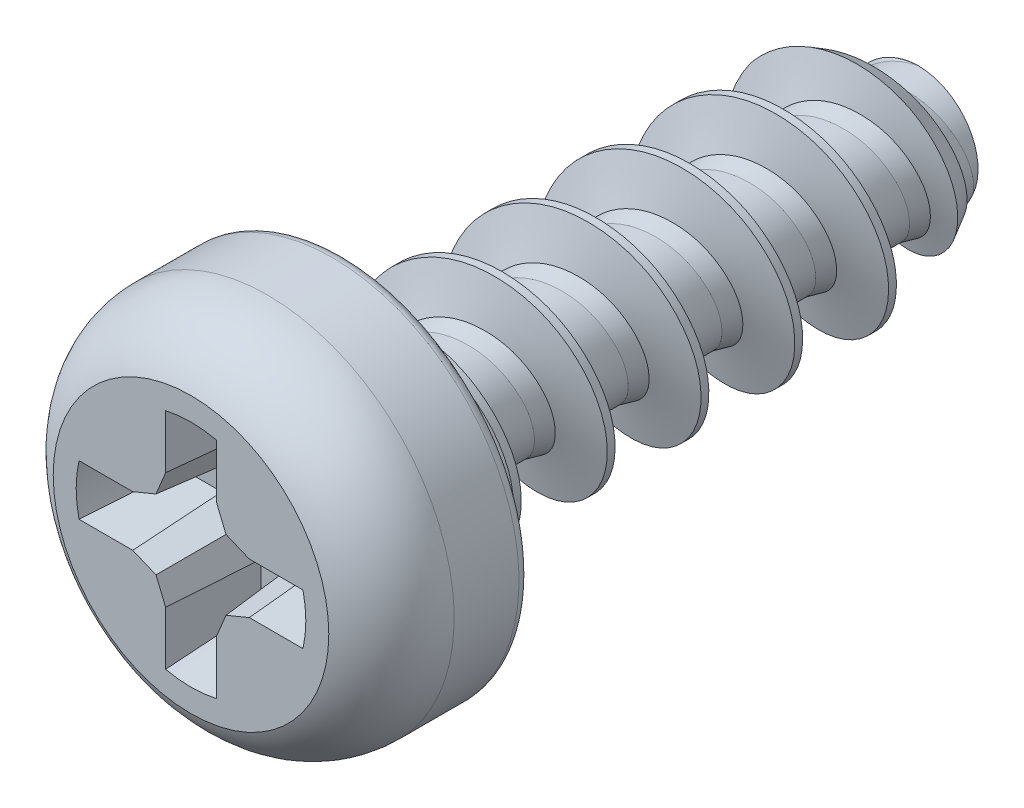
from build123d import *

# Parameters (mm, degrees)
CUT_EXTRUDE1_DEPTH      = 0.914285714
CIRPATTERN1_COUNT       = 4
DRAFT2_ANGLE            = 5
FILLET1_R               = 0.1225
SWEEP2_PITCH            = 0.98
CUT_EXTRUDE4_DEPTH      = 9.132806369
CUT_EXTRUDE4_DEPTH_BACK = 9.132806369
SKETCH16_W              = 1.6
SKETCH16_H              = 3.9
SKETCH16_W_2            = 2.45
SKETCH14_R              = 1.1
BOSS_EXTRUDE3_DEPTH     = 0.3
SKETCH15_R              = 1.1
BOSS_EXTRUDE4_DEPTH     = 0.9
BOSS_EXTRUDE4_DRAFT     = -39


# Read off the part's stored shape, not the designer's step: Draft1
with BuildPart() as part:
    # Sketch3 → Revolve1 (revolve)
    with BuildSketch(Plane(origin=(0, 0, 0), x_dir=(0, 0, -1), z_dir=(1, 0, 0)), mode=Mode.PRIVATE) as revolve1_sk:
        Polygon((0, 0.625), (0, 1.95), (-1.6, 1.95), (-1.6, 0), (6, 0), (6, 0.625), align=None)
    revolve(revolve1_sk.sketch.rotate(Axis((0, 0, 1.6), (0, 0, -1)), 180), axis=Axis((0, 0, 1.6), (0, 0, -1)))

    # Sketch4 → Cut-Revolve1 (revolve, cut)
    with BuildSketch(Plane(origin=(0, 0, 0), x_dir=(0, 0, -1), z_dir=(1, 0, 0)), mode=Mode.PRIVATE) as cut_revolve1_sk:
        with BuildLine():
            Line((-1.6, 1.44), (-1.8, 1.44))
            Line((-1.8, 1.44), (-1.8, 2.15))
            Line((-1.8, 2.15), (0, 2.15))
            Line((0, 2.15), (0, 1.95))
            Line((0, 1.95), (-0.8, 1.95))
            ThreePointArc((-0.8, 1.95), (-1.274368001, 1.811655687), (-1.6, 1.44))
        make_face()
    revolve(cut_revolve1_sk.sketch.rotate(Axis((0, 0, 0), (0, 0, 1)), 180), axis=Axis((0, 0, 0), (0, 0, 1)), mode=Mode.SUBTRACT)

    # Sketch5 → Cut-Extrude1 (cut)
    with BuildSketch(Plane.XY.offset(1.6)):
        with BuildLine():
            Line((0, 1.2), (0, 0))
            Line((0, 0), (1.2, 0))
            ThreePointArc((1.2, 0), (1.196398288, 0.092903843), (1.185614793, 0.18525))
            Line((1.185614793, 0.18525), (0.592807397, 0.18525))
            Line((0.592807397, 0.18525), (0.304620798, 0.304620798))
            Line((0.304620798, 0.304620798), (0.18525, 0.592807397))
            Line((0.18525, 0.592807397), (0.18525, 1.185614793))
            ThreePointArc((0.18525, 1.185614793), (0.092903844, 1.196398293), (0, 1.2))
        make_face()
    cut_extrude1 = extrude(amount=-CUT_EXTRUDE1_DEPTH, mode=Mode.SUBTRACT)

    # CirPattern1: Cut-Extrude1 ×4 about axis
    cirpattern1_axis = Axis((0, 0, 0), (0, 0, 1))
    for i in range(1, CIRPATTERN1_COUNT):
        add(cut_extrude1.rotate(cirpattern1_axis, i * 360 / CIRPATTERN1_COUNT), mode=Mode.SUBTRACT)

    # Draft1 outline → Draft1 (revolve)
    with BuildSketch(Plane.XZ):
        Polygon((1.2, 1.6), (1.03878676, 0.685714286), (1.2, 0.685714286), align=None)
    revolve(axis=Axis((0, 0, 0), (0, 0, 1)))

    # Draft2
    draft2_faces = [part.faces().sort_by_distance(p)[0] for p in [
        (0.18525, 0.850547535, 1.167225457),
        (0.244935399, 0.448714097, 1.142857143),
        (0.448714097, 0.244935399, 1.142857143),
        (0.850547535, 0.18525, 1.167225457),
        (0.850547535, -0.18525, 1.167225457),
        (0.448714097, -0.244935399, 1.142857143),
        (0.244935399, -0.448714097, 1.142857143),
        (0.18525, -0.850547535, 1.167225457),
        (-0.18525, -0.850547535, 1.167225457),
        (-0.244935399, -0.448714097, 1.142857143),
        (-0.448714097, -0.244935399, 1.142857143),
        (-0.850547535, -0.18525, 1.167225457),
        (-0.850547535, 0.18525, 1.167225457),
        (-0.448714097, 0.244935399, 1.142857143),
        (-0.244935399, 0.448714097, 1.142857143),
        (-0.18525, 0.850547535, 1.167225457),
    ]]
    draft(draft2_faces, Plane(origin=(-1.837e-06, -1.43e-07, 0.685714286), x_dir=(1, 0, 0), z_dir=(0, 0, 1)), DRAFT2_ANGLE)

    # Fillet1
    fillet1_edges = [part.edges().sort_by_distance(p)[0] for p in [
        (0, 1.95, 0),
    ]]
    fillet(fillet1_edges, radius=FILLET1_R)


with BuildPart() as body_2:
    # Split1: the piece on the far side of the plane
    add(part.part)
    split(bisect_by=Plane.XY, keep=Keep.BOTTOM)

    # Sweep2: the profile of Sketch9 screwed along a right-hand helix of 8.122449 turns, 8 arcs to a turn; built about Z, then put on its axis
    sweep2_z = Axis((0, 0, 0), (0, 0, 1))
    sweep2_corners = [(1.1, 0, -0.294658045), (1.1, 0, -0.376324711), (0.665833333, 0, -0.492659319), (0.625, 0, -0.670982756), (0.463471328, 0, -0.670982756), (0.463471328, 0, 0), (0.625, 0, 0), (0.665833333, 0, -0.178323437)]
    with BuildLine(mode=Mode.PRIVATE) as sweep2_profile:
        Line(sweep2_corners[0], sweep2_corners[1])
        Line(sweep2_corners[1], sweep2_corners[2])
        Line(sweep2_corners[2], sweep2_corners[3])
        Line(sweep2_corners[3], sweep2_corners[4])
        Line(sweep2_corners[4], sweep2_corners[5])
        Line(sweep2_corners[5], sweep2_corners[6])
        Line(sweep2_corners[6], sweep2_corners[7])
        Line(sweep2_corners[7], sweep2_corners[0])
    sweep2_cap = Face(sweep2_profile.wire())
    sweep2_turn_angles = [0, 22.5, 45, 67.5, 90, 112.5, 135, 157.5, 180, 202.5, 225, 247.5, 270, 292.5, 315, 337.5, 360]
    sweep2_turn_weights = [1, 0.9238795325112867, 1, 0.9238795325112867, 1, 0.9238795325112867, 1, 0.9238795325112867, 1, 0.9238795325112867, 1, 0.9238795325112867, 1, 0.9238795325112867, 1, 0.9238795325112867, 1]
    sweep2_turn_rails = [Edge.make_bspline([Vector(p[0], p[1], 0).rotate(sweep2_z, sweep2_turn_angles[k]) / sweep2_turn_weights[k] + Vector(0, 0, p[2] + SWEEP2_PITCH * sweep2_turn_angles[k] / 360) for k in range(17)], [0, 0, 0, 1, 1, 2, 2, 3, 3, 4, 4, 5, 5, 6, 6, 7, 7, 8, 8, 8], 2, sweep2_turn_weights) for p in sweep2_corners]
    sweep2_turn_sides = [Face.make_surface_from_curves(sweep2_turn_rails[p[0]], sweep2_turn_rails[p[1]]) for p in [(0, 1), (1, 2), (2, 3), (3, 4), (4, 5), (5, 6), (6, 7), (7, 0)]]
    sweep2_last_angles = [2880, 2902.040816327, 2924.081632653]
    sweep2_last_weights = [1, 0.9269167573459905, 1]
    sweep2_last_rails = [Edge.make_bspline([Vector(p[0], p[1], 0).rotate(sweep2_z, sweep2_last_angles[k]) / sweep2_last_weights[k] + Vector(0, 0, p[2] + SWEEP2_PITCH * sweep2_last_angles[k] / 360) for k in range(3)], [0, 0, 0, 1, 1, 1], 2, sweep2_last_weights) for p in sweep2_corners]
    sweep2_last_sides = [Face.make_surface_from_curves(sweep2_last_rails[p[0]], sweep2_last_rails[p[1]]) for p in [(0, 1), (1, 2), (2, 3), (3, 4), (4, 5), (5, 6), (6, 7), (7, 0)]]
    sweep2 = Plane(origin=(0, 0, -6.98), x_dir=(0, 1, 0), z_dir=(0, 0, 1)) * Solid(Shell([*[p.moved(Location((0, 0, SWEEP2_PITCH * i))) for i in range(8) for p in sweep2_turn_sides], *sweep2_last_sides, sweep2_cap, sweep2_cap.rotate(sweep2_z, 2924.081632653).moved(Location((0, 0, SWEEP2_PITCH * 2924.081632653 / 360)))]))
    add(sweep2)

    # Sketch16 → Cut-Extrude4 (cut, two sides: drawn at the far end of the back side and taken through both)
    with BuildSketch(Plane(origin=(0, 0, 0), x_dir=(0, 0, -1), z_dir=(1, 0, 0)).offset(-CUT_EXTRUDE4_DEPTH_BACK)):
        with Locations((-0.8, 0)):
            Rectangle(SKETCH16_W, SKETCH16_H)
        with Locations((7.225, 0)):
            Rectangle(SKETCH16_W_2, SKETCH16_H)
    extrude(amount=CUT_EXTRUDE4_DEPTH + CUT_EXTRUDE4_DEPTH_BACK, mode=Mode.SUBTRACT)

    # Sketch13 → Cut-Revolve2 (revolve, cut)
    with BuildSketch(Plane(origin=(0, 0, 0), x_dir=(0, 0, -1), z_dir=(1, 0, 0))):
        Polygon((6, 1.95), (6, 0.625), (3.658070428, 1.95), align=None)
    revolve(axis=Axis((0, 0, 0), (0, 0, -1)), mode=Mode.SUBTRACT)


with BuildPart() as part_1:
    add(part.part)

    # Split1
    split(bisect_by=Plane.XY, keep=Keep.TOP)

    add(body_2.part)  # Boss-Extrude3 merges body 2
    # Sketch14 → Boss-Extrude3 (add)
    with BuildSketch(Plane.XY):
        Circle(SKETCH14_R)
    extrude(amount=-BOSS_EXTRUDE3_DEPTH)


with BuildPart() as boss_extrude4_tool:
    # Sketch15 → Boss-Extrude4 (with draft: the straight prism first)
    with BuildSketch(Plane.XY.offset(-0.3)):
        Circle(SKETCH15_R)
    extrude(amount=-BOSS_EXTRUDE4_DEPTH)
    # Boss-Extrude4: the draft: its side faces are tilted about the plane it starts from
    boss_extrude4_sides = [boss_extrude4_tool.faces().sort_by_distance(p)[0] for p in [
        (-1.1, 0, -0.75),
    ]]
    draft(boss_extrude4_sides, Plane.XY.offset(-0.3), BOSS_EXTRUDE4_DRAFT)


with BuildPart() as part_2:
    add(part_1.part)

    # Boss-Extrude4: add boss_extrude4_tool
    add(boss_extrude4_tool.part)


solid = part_2.part
